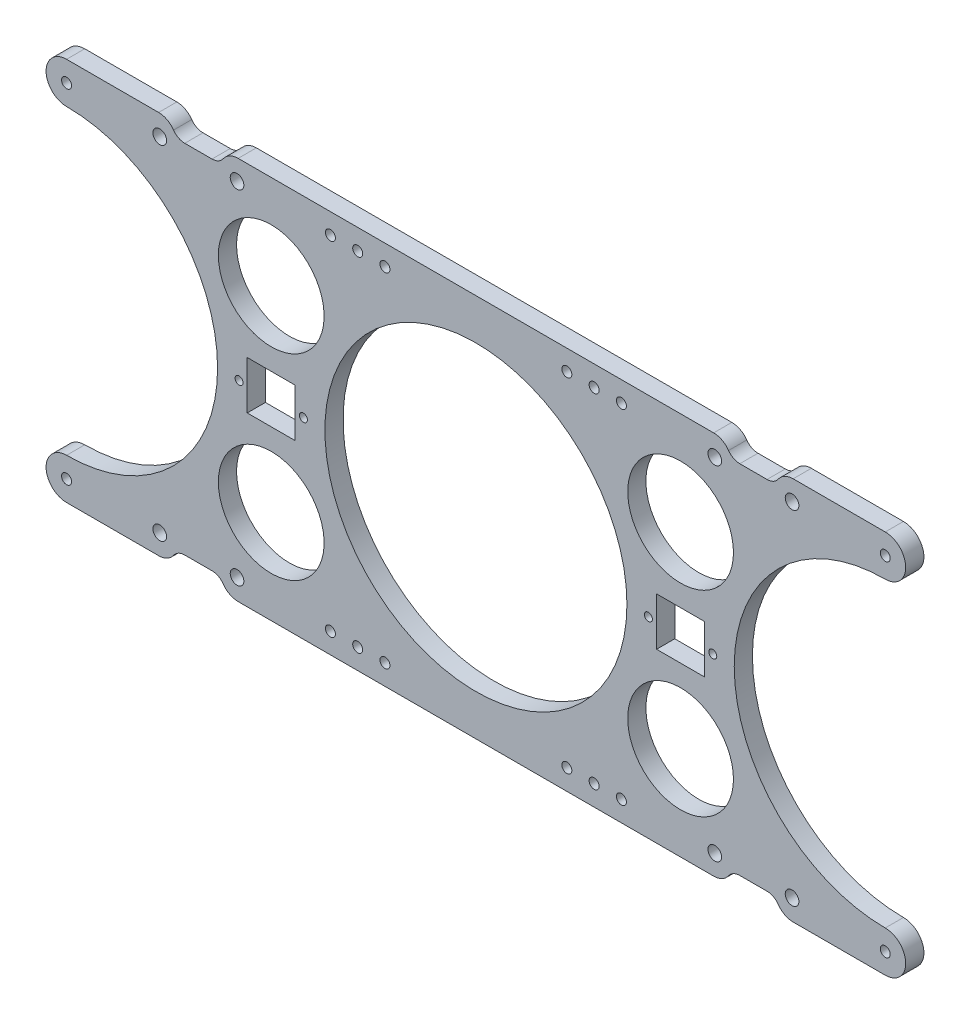
from build123d import *

# Parameters (mm, degrees)
SKETCH1_R            = 83.05
SKETCH1_R_2          = 29.075
SKETCH1_R_3          = 2.2
SKETCH1_R_4          = 3.75
SKETCH1_W            = 26.4
SKETCH1_H            = 26.4
BOSS_EXTRUDE1_DEPTH  = 5
M5_CLEARANCE_HOLE1_D = 5.5
FILLET1_R            = 10


with BuildPart() as part:
    # Sketch1 → Boss-Extrude1 (new, symmetric)
    with BuildSketch(Plane.XY):
        with BuildLine():
            Line((-225.104242519, 105.55), (-167.604242519, 105.55))
            ThreePointArc((-167.604242519, 105.55), (-165.407543378, 100.246699141), (-160.104242519, 98.05))
            Line((-160.104242519, 98.05), (-145.104242519, 98.05))
            ThreePointArc((-145.104242519, 98.05), (-139.80094166, 100.246699141), (-137.604242519, 105.55))
            Line((-137.604242519, 105.55), (137.604242519, 105.55))
            ThreePointArc((137.604242519, 105.55), (139.80094166, 100.246699141), (145.104242519, 98.05))
            Line((145.104242519, 98.05), (160.104242519, 98.05))
            ThreePointArc((160.104242519, 98.05), (165.407543378, 100.246699141), (167.604242519, 105.55))
            Line((167.604242519, 105.55), (225.104242519, 105.55))
            ThreePointArc((225.104242519, 105.55), (236.354242519, 94.3), (225.104242519, 83.05))
            ThreePointArc((225.104242519, 83.05), (142.054242519, 0), (225.104242519, -83.05))
            ThreePointArc((225.104242519, -83.05), (236.354242519, -94.3), (225.104242519, -105.55))
            Line((225.104242519, -105.55), (167.604242519, -105.55))
            ThreePointArc((167.604242519, -105.55), (165.407543378, -100.246699141), (160.104242519, -98.05))
            Line((160.104242519, -98.05), (145.104242519, -98.05))
            ThreePointArc((145.104242519, -98.05), (139.80094166, -100.246699141), (137.604242519, -105.55))
            Line((137.604242519, -105.55), (-137.604242519, -105.55))
            ThreePointArc((-137.604242519, -105.55), (-139.80094166, -100.246699141), (-145.104242519, -98.05))
            Line((-145.104242519, -98.05), (-160.104242519, -98.05))
            ThreePointArc((-160.104242519, -98.05), (-165.407543378, -100.246699141), (-167.604242519, -105.55))
            Line((-167.604242519, -105.55), (-225.104242519, -105.55))
            ThreePointArc((-225.104242519, -105.55), (-236.354242519, -94.3), (-225.104242519, -83.05))
            ThreePointArc((-225.104242519, -83.05), (-142.054242519, 0), (-225.104242519, 83.05))
            ThreePointArc((-225.104242519, 83.05), (-236.354242519, 94.3), (-225.104242519, 105.55))
        make_face()
        Circle(SKETCH1_R, mode=Mode.SUBTRACT)
        with Locations((112.552121259, 53.975)):
            Circle(SKETCH1_R_2, mode=Mode.SUBTRACT)
        with Locations((112.552121259, -53.975)):
            Circle(SKETCH1_R_2, mode=Mode.SUBTRACT)
        with Locations((-112.552121259, -53.975)):
            Circle(SKETCH1_R_2, mode=Mode.SUBTRACT)
        with Locations((-112.552121259, 53.975)):
            Circle(SKETCH1_R_2, mode=Mode.SUBTRACT)
        with Locations((94.852121259, 0)):
            Circle(SKETCH1_R_3, mode=Mode.SUBTRACT)
        with Locations((130.252121259, 0)):
            Circle(SKETCH1_R_3, mode=Mode.SUBTRACT)
        with Locations((-130.252121259, 0)):
            Circle(SKETCH1_R_3, mode=Mode.SUBTRACT)
        with Locations((-94.852121259, 0)):
            Circle(SKETCH1_R_3, mode=Mode.SUBTRACT)
        with Locations((-173.854242519, 94.3)):
            Circle(SKETCH1_R_4, mode=Mode.SUBTRACT)
        with Locations((-131.354242519, 94.3)):
            Circle(SKETCH1_R_4, mode=Mode.SUBTRACT)
        with Locations((-131.354242519, -94.3)):
            Circle(SKETCH1_R_4, mode=Mode.SUBTRACT)
        with Locations((-173.854242519, -94.3)):
            Circle(SKETCH1_R_4, mode=Mode.SUBTRACT)
        with Locations((131.354242519, -94.3)):
            Circle(SKETCH1_R_4, mode=Mode.SUBTRACT)
        with Locations((173.854242519, -94.3)):
            Circle(SKETCH1_R_4, mode=Mode.SUBTRACT)
        with Locations((131.354242519, 94.3)):
            Circle(SKETCH1_R_4, mode=Mode.SUBTRACT)
        with Locations((173.854242519, 94.3)):
            Circle(SKETCH1_R_4, mode=Mode.SUBTRACT)
        with Locations((-112.552121259, 0)):
            Rectangle(SKETCH1_W, SKETCH1_H, mode=Mode.SUBTRACT)
        with Locations((112.552121259, 0)):
            Rectangle(SKETCH1_W, SKETCH1_H, mode=Mode.SUBTRACT)
    extrude(amount=BOSS_EXTRUDE1_DEPTH, both=True)

    # M5 Clearance Hole1 (through all)
    with Locations(Plane.XY.offset(5)):
        with Locations((-80, 94.3), (-65, 94.3), (-50, 94.3), (50, 94.3), (65, 94.3), (80, 94.3), (-80, -94.3), (-65, -94.3), (-50, -94.3), (50, -94.3), (65, -94.3), (80, -94.3), (0, 0), (-225.104242519, 94.3), (225.104242519, 94.3), (225.104242519, -94.3), (-225.104242519, -94.3)):
            Hole(M5_CLEARANCE_HOLE1_D / 2)

    # Fillet1
    fillet1_edges = [part.edges().sort_by_distance(p)[0] for p in [
        (167.604242519, 105.55, 0),
        (137.604242519, 105.55, 0),
        (167.604242519, -105.55, 0),
        (137.604242519, -105.55, 0),
        (-137.604242519, -105.55, 0),
        (-167.604242519, -105.55, 0),
        (-137.604242519, 105.55, 0),
        (-167.604242519, 105.55, 0),
    ]]
    fillet(fillet1_edges, radius=FILLET1_R)


solid = part.part
